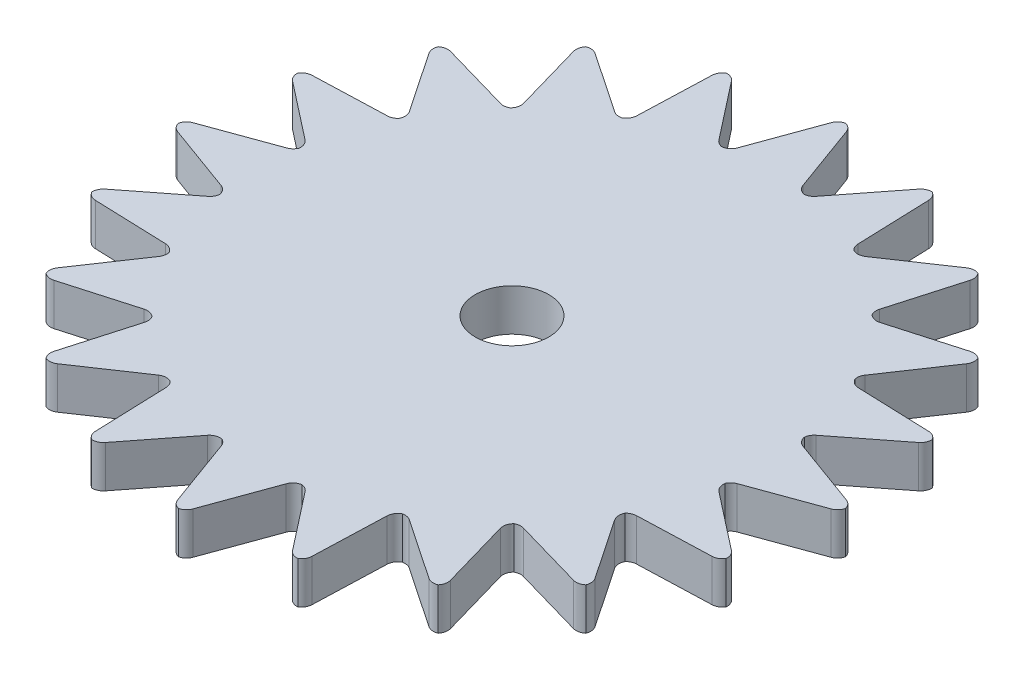
from build123d import *
from build123d.topology import SkipClean

# Parameters (mm, degrees)
SKETCH1_R          = 17.304
BASE_FLANGE2_DEPTH = 2.85
TAB1_DEPTH         = 2.85
FILLET1_R          = 0.75
CIRPATTERN1_START  = -2.85
CIRPATTERN1_DEPTH  = 2.85
SKETCH11_R         = 2.5
CUT_EXTRUDE1_DEPTH = 33.191043281


# Read off the part's stored shape, not the designer's step: CirPattern1
# Sheet-metal steps are written as plain solids
with BuildPart() as part:
    # Sketch1 → Base-Flange2 (new body)
    with BuildSketch(Plane(origin=(0, 0, 0), x_dir=(1, 0, 0), z_dir=(0, 1, 0))):
        with Locations(Location((0, 0, 0), (0, 0, 270))):
            Circle(SKETCH1_R)
    extrude(amount=-BASE_FLANGE2_DEPTH)

    # Sketch10 → Tab1 (add)
    with SkipClean():  # the faces are left unmerged after this step: merging them gives an invalid solid
        with BuildSketch(Plane(origin=(0, 0, 0), x_dir=(1, 0, 0), z_dir=(0, 1, 0))):
            with BuildLine():
                Line((0.344974946, 22.693378071), (2.365683372, 17.1415273))
                ThreePointArc((2.365683372, 17.1415273), (2.536438701, 17.117093641), (2.706941983, 17.090959046))
                Line((2.706941983, 17.090959046), (0, 0))
                Line((0, 0), (-2.706941983, 17.090959046))
                ThreePointArc((-2.706941983, 17.090959046), (-2.536438701, 17.117093641), (-2.365683372, 17.1415273))
                Line((-2.365683372, 17.1415273), (-0.344974946, 22.693378071))
                ThreePointArc((-0.344974946, 22.693378071), (0, 22.696), (0.344974946, 22.693378071))
            make_face()
        extrude(amount=-TAB1_DEPTH)

    # Fillet1
    # the kernel refuses this fillet: 0.75 mm, written as the material it adds along each edge
    with BuildSketch(Plane(origin=(-2.365683372, 0, -17.1415273), x_dir=(-0.9888093822345249, 0, 0.14918446837716476), z_dir=(0, -1, 0))) as fillet1_piece_1:
        with BuildLine():
            CenterArc((0.445529852, 0.749940458), FILLET1_R, 208.579668276, 60.698354923)
            Line((-0.213084738, 0.391155255), (0, 0))
            ThreePointArc((0, 0), (0.218039724, 0.001373764), (0.436079448, 0))
        make_face()
    extrude(amount=2.85)
    with BuildSketch(Plane(origin=(2.365683372, 0, -17.1415273), x_dir=(0.9888093822345239, 0, 0.1491844683771712), z_dir=(0, -1, 0))) as fillet1_piece_2:
        with BuildLine():
            CenterArc((0.445529852, -0.749940458), FILLET1_R, 90.7219768, 60.698354923)
            Line((-0.213084738, -0.391155255), (0, 0))
            ThreePointArc((0, 0), (0.218039724, -0.001373764), (0.436079448, 0))
        make_face()
    extrude(amount=2.85)
    # the kernel refuses this fillet: 0.75 mm, written as the material it takes off along each edge
    with BuildSketch(Plane(origin=(-0.344974946, 1.33005724, -22.693378071), x_dir=(0.999993946552087, 0, -0.0034794912246322507), z_dir=(0, -1, 0))) as fillet1_2_piece_1:
        with BuildLine():
            CenterArc((0.523232423, 0.749948483), FILLET1_R, 200.199360564, 70.472197519)
            Line((-0.180640235, 0.490982689), (0, 0))
            ThreePointArc((0, 0), (0.266011448, -0.001558965), (0.532022896, 0))
        make_face()
    extrude(amount=5.510114481, mode=Mode.SUBTRACT)
    with BuildSketch(Plane(origin=(0.344974946, 1.33005724, -22.693378071), x_dir=(0.3420201433256632, 0, 0.9396926207859104), z_dir=(0, -1, 0))) as fillet1_2_piece_2:
        with BuildLine():
            CenterArc((0.523158576, 0.75), FILLET1_R, 199.527802481, 70.472197519)
            ThreePointArc((-0.183700976, 0.499301826), (-0.093313571, 0.249112622), (0, 0))
            Line((0, 0), (0.523158576, 0))
        make_face()
    extrude(amount=5.510114481, mode=Mode.SUBTRACT)

    # CirPattern1 outline → CirPattern1 (add)
    with BuildSketch(Plane(origin=(0, 0, 0), x_dir=(1, 0, 0), z_dir=(0, 1, 0)).offset(CIRPATTERN1_START)):
        with BuildLine():
            ThreePointArc((-7.006379486, 21.563418798), (-7.258815182, 21.302325208), (-7.358988125, 20.953242088))
            Line((-7.358988125, 20.953242088), (-7.531376562, 16.016683141))
            ThreePointArc((-7.531376562, 16.016683141), (-7.647317521, 15.641549527), (-7.936913381, 15.376404715))
            ThreePointArc((-7.936913381, 15.376404715), (-5.433797161, 16.428702457), (-2.796882821, 17.07647102))
            ThreePointArc((-2.796882821, 17.07647102), (-3.077876103, 17.167411509), (-3.30197197, 17.359787286))
            Line((-3.30197197, 17.359787286), (-6.362460233, 21.277033629))
            ThreePointArc((-6.362460233, 21.277033629), (-6.648687756, 21.500567627), (-7.006379486, 21.563418798))
        make_face()
        with BuildLine():
            ThreePointArc((2.796882821, 17.07647102), (5.347230071, 16.457081958), (7.774572093, 15.459121734))
            ThreePointArc((7.774572093, 15.459121734), (7.600697231, 15.697857842), (7.532475511, 15.98521336))
            Line((7.532475511, 15.98521336), (7.358988125, 20.953242088))
            ThreePointArc((7.358988125, 20.953242088), (7.258815182, 21.302325208), (7.006379486, 21.563418798))
            ThreePointArc((7.006379486, 21.563418798), (6.648687756, 21.500567627), (6.362460233, 21.277033629))
            Line((6.362460233, 21.277033629), (3.30197197, 17.359787286))
            ThreePointArc((3.30197197, 17.359787286), (3.077876103, 17.167411509), (2.796882821, 17.07647102))
        make_face()
        with BuildLine():
            ThreePointArc((7.774572093, 15.459121734), (10.097193648, 14.052583266), (12.171188784, 12.30002356))
            ThreePointArc((12.171188784, 12.30002356), (12.079597479, 12.580805379), (12.103512506, 12.875178388))
            Line((12.103512506, 12.875178388), (13.473721503, 17.653665034))
            ThreePointArc((13.473721503, 17.653665034), (13.486323989, 18.016617952), (13.326925731, 18.342939632))
            ThreePointArc((13.326925731, 18.342939632), (12.9673186, 18.393697438), (12.626024245, 18.269553142))
            Line((12.626024245, 18.269553142), (8.530936781, 15.507381771))
            ThreePointArc((8.530936781, 15.507381771), (8.159298927, 15.380681971), (7.774572093, 15.459121734))
        make_face()
        with BuildLine():
            ThreePointArc((12.171188784, 12.30002356), (13.945488859, 10.244596453), (15.376404716, 7.936913381))
            ThreePointArc((15.376404716, 7.936913381), (15.376062561, 8.232256029), (15.489773366, 8.504831248))
            Line((15.489773366, 8.504831248), (18.269553142, 12.626024245))
            ThreePointArc((18.269553142, 12.626024245), (18.393697438, 12.9673186), (18.342939632, 13.326925731))
            ThreePointArc((18.342939632, 13.326925731), (18.016617952, 13.486323989), (17.653665034, 13.473721503))
            Line((17.653665034, 13.473721503), (12.905447521, 12.11219204))
            ThreePointArc((12.905447521, 12.11219204), (12.512846527, 12.106535782), (12.171188784, 12.30002356))
        make_face()
        with BuildLine():
            ThreePointArc((15.376404716, 7.936913381), (16.428702457, 5.433797161), (17.07647102, 2.796882821))
            ThreePointArc((17.07647102, 2.796882821), (17.167411509, 3.077876103), (17.359787286, 3.30197197))
            Line((17.359787286, 3.30197197), (21.277033629, 6.362460233))
            ThreePointArc((21.277033629, 6.362460233), (21.500567627, 6.648687756), (21.563418798, 7.006379486))
            ThreePointArc((21.563418798, 7.006379486), (21.302325208, 7.258815182), (20.953242088, 7.358988125))
            Line((20.953242088, 7.358988125), (16.016683141, 7.531376562))
            ThreePointArc((16.016683141, 7.531376562), (15.641549527, 7.647317521), (15.376404716, 7.936913381))
        make_face()
        with BuildLine():
            ThreePointArc((17.07647102, 2.796882821), (17.303760193, 0.091099943), (17.104973362, -2.616926117))
            ThreePointArc((17.104973362, -2.616926117), (17.278294606, -2.377787782), (17.530504274, -2.224107332))
            Line((17.530504274, -2.224107332), (22.201769818, -0.523905717))
            ThreePointArc((22.201769818, -0.523905717), (22.502812452, -0.32076297), (22.673120292, 0))
            ThreePointArc((22.673120292, 0), (22.502812452, 0.32076297), (22.201769818, 0.523905717))
            Line((22.201769818, 0.523905717), (17.560094219, 2.213337472))
            ThreePointArc((17.560094219, 2.213337472), (17.239148678, 2.439526538), (17.07647102, 2.796882821))
        make_face()
        with BuildLine():
            ThreePointArc((17.104973362, -2.616926117), (16.485005318, -5.260514771), (15.459121734, -7.774572093))
            ThreePointArc((15.459121734, -7.774572093), (15.697857842, -7.600697231), (15.98521336, -7.532475511))
            Line((15.98521336, -7.532475511), (20.953242088, -7.358988125))
            ThreePointArc((20.953242088, -7.358988125), (21.302325208, -7.258815182), (21.563418798, -7.006379486))
            ThreePointArc((21.563418798, -7.006379486), (21.500567627, -6.648687756), (21.277033629, -6.362460233))
            Line((21.277033629, -6.362460233), (17.384600927, -3.321358511))
            ThreePointArc((17.384600927, -3.321358511), (17.149259844, -3.0070623), (17.104973362, -2.616926117))
        make_face()
        with BuildLine():
            ThreePointArc((15.459121734, -7.774572093), (14.052583266, -10.097193648), (12.30002356, -12.171188784))
            ThreePointArc((12.30002356, -12.171188784), (12.580805379, -12.079597479), (12.875178388, -12.103512506))
            Line((12.875178388, -12.103512506), (17.653665034, -13.473721503))
            ThreePointArc((17.653665034, -13.473721503), (18.016617952, -13.486323989), (18.342939632, -13.326925731))
            ThreePointArc((18.342939632, -13.326925731), (18.393697438, -12.9673186), (18.269553142, -12.626024245))
            Line((18.269553142, -12.626024245), (15.507381771, -8.530936781))
            ThreePointArc((15.507381771, -8.530936781), (15.380681971, -8.159298927), (15.459121734, -7.774572093))
        make_face()
        with BuildLine():
            ThreePointArc((12.30002356, -12.171188784), (10.244596453, -13.945488859), (7.936913381, -15.376404716))
            ThreePointArc((7.936913381, -15.376404716), (8.232256029, -15.376062561), (8.504831248, -15.489773366))
            Line((8.504831248, -15.489773366), (12.626024245, -18.269553142))
            ThreePointArc((12.626024245, -18.269553142), (12.9673186, -18.393697438), (13.326925731, -18.342939632))
            ThreePointArc((13.326925731, -18.342939632), (13.486323989, -18.016617952), (13.473721503, -17.653665034))
            Line((13.473721503, -17.653665034), (12.11219204, -12.905447521))
            ThreePointArc((12.11219204, -12.905447521), (12.106535782, -12.512846527), (12.30002356, -12.171188784))
        make_face()
        with BuildLine():
            ThreePointArc((7.936913381, -15.376404716), (5.433797161, -16.428702457), (2.796882821, -17.07647102))
            ThreePointArc((2.796882821, -17.07647102), (3.077876103, -17.167411509), (3.30197197, -17.359787286))
            Line((3.30197197, -17.359787286), (6.362460233, -21.277033629))
            ThreePointArc((6.362460233, -21.277033629), (6.648687756, -21.500567627), (7.006379486, -21.563418798))
            ThreePointArc((7.006379486, -21.563418798), (7.258815182, -21.302325208), (7.358988125, -20.953242088))
            Line((7.358988125, -20.953242088), (7.531376562, -16.016683141))
            ThreePointArc((7.531376562, -16.016683141), (7.647317521, -15.641549527), (7.936913381, -15.376404716))
        make_face()
        with BuildLine():
            ThreePointArc((2.796882821, -17.07647102), (0.091099943, -17.303760193), (-2.616926117, -17.104973362))
            ThreePointArc((-2.616926117, -17.104973362), (-2.377787782, -17.278294606), (-2.224107332, -17.530504274))
            Line((-2.224107332, -17.530504274), (-0.523905717, -22.201769818))
            ThreePointArc((-0.523905717, -22.201769818), (-0.32076297, -22.502812452), (0, -22.673120292))
            ThreePointArc((0, -22.673120292), (0.32076297, -22.502812452), (0.523905717, -22.201769818))
            Line((0.523905717, -22.201769818), (2.213337472, -17.560094219))
            ThreePointArc((2.213337472, -17.560094219), (2.439526538, -17.239148678), (2.796882821, -17.07647102))
        make_face()
        with BuildLine():
            ThreePointArc((-2.616926117, -17.104973362), (-5.260514771, -16.485005318), (-7.774572093, -15.459121734))
            ThreePointArc((-7.774572093, -15.459121734), (-7.600697231, -15.697857842), (-7.532475511, -15.98521336))
            Line((-7.532475511, -15.98521336), (-7.358988125, -20.953242088))
            ThreePointArc((-7.358988125, -20.953242088), (-7.258815182, -21.302325208), (-7.006379486, -21.563418798))
            ThreePointArc((-7.006379486, -21.563418798), (-6.648687756, -21.500567627), (-6.362460233, -21.277033629))
            Line((-6.362460233, -21.277033629), (-3.321358511, -17.384600927))
            ThreePointArc((-3.321358511, -17.384600927), (-3.0070623, -17.149259844), (-2.616926117, -17.104973362))
        make_face()
        with BuildLine():
            ThreePointArc((-7.774572093, -15.459121734), (-10.097193648, -14.052583266), (-12.171188784, -12.30002356))
            ThreePointArc((-12.171188784, -12.30002356), (-12.079597479, -12.580805379), (-12.103512506, -12.875178388))
            Line((-12.103512506, -12.875178388), (-13.473721503, -17.653665034))
            ThreePointArc((-13.473721503, -17.653665034), (-13.486323989, -18.016617952), (-13.326925731, -18.342939632))
            ThreePointArc((-13.326925731, -18.342939632), (-12.9673186, -18.393697438), (-12.626024245, -18.269553142))
            Line((-12.626024245, -18.269553142), (-8.530936781, -15.507381771))
            ThreePointArc((-8.530936781, -15.507381771), (-8.159298927, -15.380681971), (-7.774572093, -15.459121734))
        make_face()
        with BuildLine():
            ThreePointArc((-12.171188784, -12.30002356), (-13.945488859, -10.244596453), (-15.376404716, -7.936913381))
            ThreePointArc((-15.376404716, -7.936913381), (-15.376062561, -8.232256029), (-15.489773366, -8.504831248))
            Line((-15.489773366, -8.504831248), (-18.269553142, -12.626024245))
            ThreePointArc((-18.269553142, -12.626024245), (-18.393697438, -12.9673186), (-18.342939632, -13.326925731))
            ThreePointArc((-18.342939632, -13.326925731), (-18.016617952, -13.486323989), (-17.653665034, -13.473721503))
            Line((-17.653665034, -13.473721503), (-12.905447521, -12.11219204))
            ThreePointArc((-12.905447521, -12.11219204), (-12.512846527, -12.106535782), (-12.171188784, -12.30002356))
        make_face()
        with BuildLine():
            ThreePointArc((-15.376404716, -7.936913381), (-16.428702457, -5.433797161), (-17.07647102, -2.796882821))
            ThreePointArc((-17.07647102, -2.796882821), (-17.167411509, -3.077876103), (-17.359787286, -3.30197197))
            Line((-17.359787286, -3.30197197), (-21.277033629, -6.362460233))
            ThreePointArc((-21.277033629, -6.362460233), (-21.500567627, -6.648687756), (-21.563418798, -7.006379486))
            ThreePointArc((-21.563418798, -7.006379486), (-21.302325208, -7.258815182), (-20.953242088, -7.358988125))
            Line((-20.953242088, -7.358988125), (-16.016683141, -7.531376562))
            ThreePointArc((-16.016683141, -7.531376562), (-15.641549527, -7.647317521), (-15.376404716, -7.936913381))
        make_face()
        with BuildLine():
            ThreePointArc((-17.07647102, -2.796882821), (-17.303760193, -0.091099943), (-17.104973362, 2.616926117))
            ThreePointArc((-17.104973362, 2.616926117), (-17.278294606, 2.377787782), (-17.530504274, 2.224107332))
            Line((-17.530504274, 2.224107332), (-22.201769818, 0.523905717))
            ThreePointArc((-22.201769818, 0.523905717), (-22.502812452, 0.32076297), (-22.673120292, 0))
            ThreePointArc((-22.673120292, 0), (-22.502812452, -0.32076297), (-22.201769818, -0.523905717))
            Line((-22.201769818, -0.523905717), (-17.560094219, -2.213337472))
            ThreePointArc((-17.560094219, -2.213337472), (-17.239148678, -2.439526538), (-17.07647102, -2.796882821))
        make_face()
        with BuildLine():
            ThreePointArc((-17.104973362, 2.616926117), (-16.485005318, 5.260514771), (-15.459121734, 7.774572093))
            ThreePointArc((-15.459121734, 7.774572093), (-15.697857842, 7.600697231), (-15.98521336, 7.532475511))
            Line((-15.98521336, 7.532475511), (-20.953242088, 7.358988125))
            ThreePointArc((-20.953242088, 7.358988125), (-21.302325208, 7.258815182), (-21.563418798, 7.006379486))
            ThreePointArc((-21.563418798, 7.006379486), (-21.500567627, 6.648687756), (-21.277033629, 6.362460233))
            Line((-21.277033629, 6.362460233), (-17.384600927, 3.321358511))
            ThreePointArc((-17.384600927, 3.321358511), (-17.149259844, 3.0070623), (-17.104973362, 2.616926117))
        make_face()
        with BuildLine():
            ThreePointArc((-15.459121734, 7.774572093), (-14.052583266, 10.097193648), (-12.30002356, 12.171188784))
            ThreePointArc((-12.30002356, 12.171188784), (-12.580805379, 12.079597479), (-12.875178388, 12.103512506))
            Line((-12.875178388, 12.103512506), (-17.653665034, 13.473721503))
            ThreePointArc((-17.653665034, 13.473721503), (-18.016617952, 13.486323989), (-18.342939632, 13.326925731))
            ThreePointArc((-18.342939632, 13.326925731), (-18.393697438, 12.9673186), (-18.269553142, 12.626024245))
            Line((-18.269553142, 12.626024245), (-15.507381771, 8.530936781))
            ThreePointArc((-15.507381771, 8.530936781), (-15.380681971, 8.159298927), (-15.459121734, 7.774572093))
        make_face()
        with BuildLine():
            ThreePointArc((-12.30002356, 12.171188784), (-10.244596453, 13.945488859), (-7.936913381, 15.376404716))
            ThreePointArc((-7.936913381, 15.376404716), (-8.232256029, 15.376062561), (-8.504831248, 15.489773366))
            Line((-8.504831248, 15.489773366), (-12.626024245, 18.269553142))
            ThreePointArc((-12.626024245, 18.269553142), (-12.9673186, 18.393697438), (-13.326925731, 18.342939632))
            ThreePointArc((-13.326925731, 18.342939632), (-13.486323989, 18.016617952), (-13.473721503, 17.653665034))
            Line((-13.473721503, 17.653665034), (-12.11219204, 12.905447521))
            ThreePointArc((-12.11219204, 12.905447521), (-12.106535782, 12.512846527), (-12.30002356, 12.171188784))
        make_face()
    extrude(amount=CIRPATTERN1_DEPTH)

    # Sketch11 → Cut-Extrude1 (cut, through all)
    with BuildSketch(Plane(origin=(0, 0, 0), x_dir=(1, 0, 0), z_dir=(0, 1, 0))):
        with Locations(Location((0, 0, 0), (0, 0, 270))):
            Circle(SKETCH11_R)
    extrude(amount=-CUT_EXTRUDE1_DEPTH, mode=Mode.SUBTRACT)


solid = part.part
